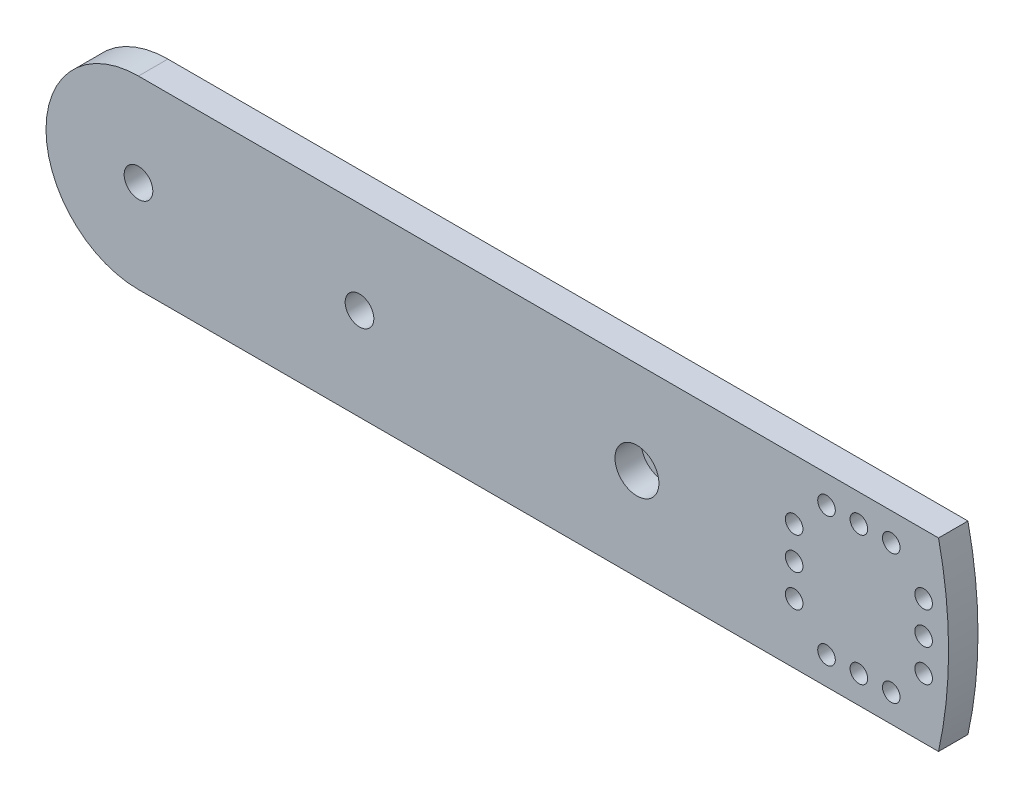
from build123d import *

# Parameters (mm, degrees)
BOSS_EXTRUDE1_DEPTH = 1.59
SKETCH6_R           = 1.55
CUT_EXTRUDE3_DEPTH  = 53.164333753
LPATTERN3_COUNT     = 2
LPATTERN3_PITCH     = 30
SKETCH7_R           = 0.95
CUT_EXTRUDE4_DEPTH  = 53.164333753
LPATTERN4_COUNT     = 2
LPATTERN4_PITCH     = 14
SKETCH8_R           = 0.95
CUT_EXTRUDE5_DEPTH  = 53.164333753
SKETCH29_R          = 1.55
CUT_EXTRUDE12_DEPTH = 53.164333753
SKETCH32_R          = 2.375
CUT_EXTRUDE15_DEPTH = 2.85


with BuildPart() as part:
    # Sketch1 → Boss-Extrude1 (new, symmetric)
    with BuildSketch(Plane.XY):
        with BuildLine():
            Line((-41.097997181, 10), (45.412002819, 10))
            ThreePointArc((45.412002819, 10), (46.5, 0), (45.412002819, -10))
            Line((45.412002819, -10), (-41.097997181, -10))
            ThreePointArc((-41.097997181, -10), (-51.097997181, 0), (-41.097997181, 10))
        make_face()
    extrude(amount=BOSS_EXTRUDE1_DEPTH, both=True)

    # Sketch6 → Cut-Extrude3 (cut, symmetric)
    with BuildSketch(Plane(origin=(0, 0, -1.59), x_dir=(-1, 0, 0), z_dir=(0, 0, -1))):
        with Locations((-12.8, 0)):
            Circle(SKETCH6_R)
    cut_extrude3 = extrude(amount=CUT_EXTRUDE3_DEPTH, both=True, mode=Mode.SUBTRACT)

    # LPattern3: Cut-Extrude3 ×2
    with Locations(*[(-i * LPATTERN3_PITCH, 0, 0) for i in range(1, LPATTERN3_COUNT)]):
        add(cut_extrude3, mode=Mode.SUBTRACT)

    # Sketch7 → Cut-Extrude4 (cut, through all)
    with BuildSketch(Plane.XY.offset(1.59)):
        with Locations((29.8, 3.5)):
            Circle(SKETCH7_R)
        with Locations((29.8, -3.5)):
            Circle(SKETCH7_R)
        with Locations((29.8, 0)):
            Circle(SKETCH7_R)
    cut_extrude4 = extrude(amount=-CUT_EXTRUDE4_DEPTH, mode=Mode.SUBTRACT)

    # LPattern4: Cut-Extrude4 ×2
    with Locations(*[(i * LPATTERN4_PITCH, 0, 0) for i in range(1, LPATTERN4_COUNT)]):
        add(cut_extrude4, mode=Mode.SUBTRACT)

    # Sketch8 → Cut-Extrude5 (cut, through all)
    with BuildSketch(Plane.XY.offset(1.59)):
        with Locations((33.3, 7)):
            Circle(SKETCH8_R)
        with Locations((40.3, 7)):
            Circle(SKETCH8_R)
        with Locations((36.8, 7)):
            Circle(SKETCH8_R)
    cut_extrude5 = extrude(amount=-CUT_EXTRUDE5_DEPTH, mode=Mode.SUBTRACT)

    # Mirror1: Cut-Extrude5 across plane
    add(cut_extrude5.mirror(Plane.ZX), mode=Mode.SUBTRACT)

    # Sketch29 → Cut-Extrude12 (cut, through all)
    with BuildSketch(Plane.XY.offset(1.59)):
        with Locations((-41.097997181, 0)):
            Circle(SKETCH29_R)
    extrude(amount=-CUT_EXTRUDE12_DEPTH, mode=Mode.SUBTRACT)

    # Sketch32 → Cut-Extrude15 (cut)
    with BuildSketch(Plane.XY.offset(1.59)):
        with Locations((12.8, 0)):
            Circle(SKETCH32_R)
    extrude(amount=-CUT_EXTRUDE15_DEPTH, mode=Mode.SUBTRACT)


solid = part.part
